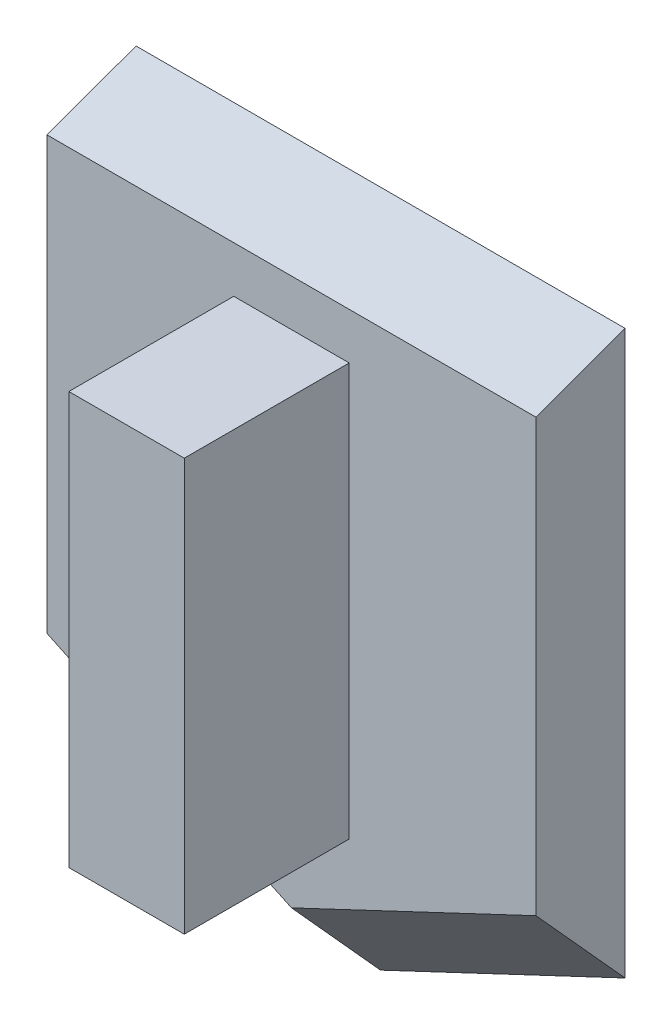
from build123d import *

# Parameters (mm, degrees)
RESSALTO_EXTRUS_O1_DEPTH = 5.4
CHANFRO1_SIZE            = 6
ESBO_O2_W                = 7
ESBO_O2_H                = 25
RESSALTO_EXTRUS_O2_DEPTH = 10
CHANFRO2_SIZE            = 6
CHANFRO2_SIZE_2          = 2.183821406


with BuildPart() as part:
    # Esboço1 → Ressalto-extrusão1 (new body)
    with BuildSketch(Plane.XY):
        Polygon((-14.825, -17.5), (0, -24.5), (14.825, -17.5), (14.825, 17.5), (-14.825, 17.5), align=None)
    extrude(amount=RESSALTO_EXTRUS_O1_DEPTH)

    # Chanfro1
    # the kernel refuses this chamfer: 6 mm, written as the material it takes off along each edge
    with BuildSketch(Plane(origin=(-13.952897525, -31.088214683, 5.4), x_dir=(0.01173996035917391, -0.024863558903536174, -0.9996219169112968), z_dir=(0.9042650014643773, 0.4269716701686773, 0)), Plane(origin=(-28.777897525, -10.911785317, 5.4), x_dir=(-0.01173996035917391, -0.024863558903536174, -0.9996219169112968), z_dir=(0.9042650014643773, -0.4269716701686773, 0))) as chanfro1_piece_1:
        Polygon((CHANFRO1_SIZE * 0.999621916911, CHANFRO1_SIZE * 0.0274958766106), (-CHANFRO1_SIZE * 0.0274958766106, CHANFRO1_SIZE * 0.999621916911), (0, 0), align=None)
    extrude(amount=47.254726193, mode=Mode.SUBTRACT)

    # Esboço2 → Ressalto-extrusão2 (add)
    with BuildSketch(Plane.XY.offset(5.4)):
        Rectangle(ESBO_O2_W, ESBO_O2_H)
    extrude(amount=RESSALTO_EXTRUS_O2_DEPTH)

    # Chanfro2
    # the kernel refuses this chamfer: 6, 2.183821406 mm, written as the material it takes off along each edge
    with BuildSketch(Plane(origin=(30.390168395, 17.5, 5.4), x_dir=(0, 0.013184058198645722, -0.9999130865277315), z_dir=(-1, 0, 0))) as chanfro2_piece_1:
        Polygon((CHANFRO2_SIZE * 0.999913086528, CHANFRO2_SIZE * 0.0131840581986), (-CHANFRO2_SIZE_2 * 0.0131840581962, CHANFRO2_SIZE_2 * 0.999913086343), (0, 0), align=None)
    extrude(amount=60.780336791, mode=Mode.SUBTRACT)


solid = part.part
